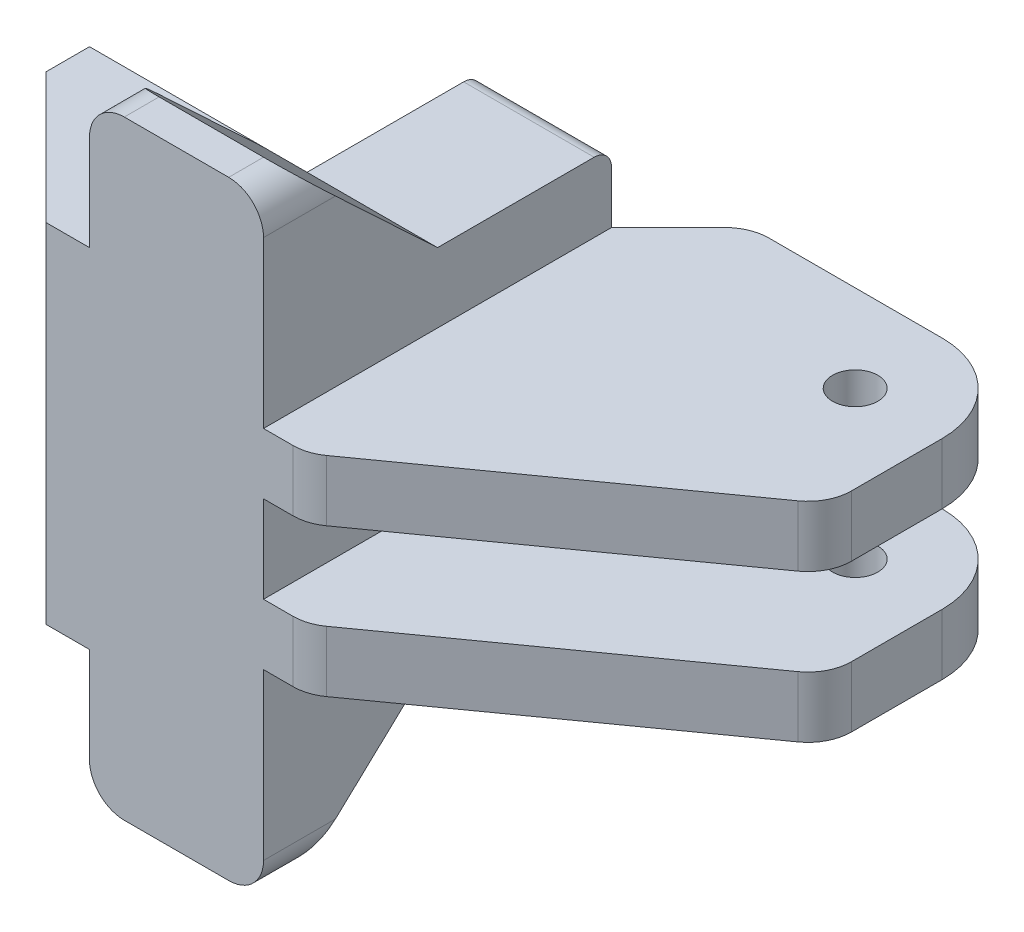
from build123d import *

# Parameters (mm, degrees)
SKETCH1_W                = 40
SKETCH1_H                = 40
BOSS_EXTRUDE1_DEPTH      = 40
SKETCH2_W                = 25
SKETCH2_H                = 20
CUT_EXTRUDE1_DEPTH       = 40
CHAMFER1_SIZE            = 15
CUT_EXTRUDE2_DEPTH       = 15
CHAMFER2_SIZE            = 4
SKETCH4_R                = 2.6
CUT_EXTRUDE3_DEPTH       = 17
BOSS_EXTRUDE2_DEPTH      = 8
BOSS_EXTRUDE2_DEPTH_BACK = 40
SKETCH5_W                = 40
SKETCH5_H                = 7
CHAMFER3_SIZE            = 35
CHAMFER3_SIZE2           = 25
CHAMFER4_SIZE            = 25
CHAMFER4_SIZE2           = 35
CHAMFER5_SIZE            = 8
FILLET1_R                = 10
FILLET2_R                = 5
SKETCH8_R                = 2.6
CUT_EXTRUDE4_DEPTH       = 34
BOSS_EXTRUDE3_DEPTH      = 20
FILLET3_R                = 4
FILLET4_R                = 2
CUT_EXTRUDE5_DEPTH       = 26
CHAMFER6_SIZE            = 2
CHAMFER6_SIZE2           = 10
FILLET5_R                = 2


with BuildPart() as part:
    # Sketch1 → Boss-Extrude1 (new body)
    with BuildSketch(Plane(origin=(0, 0, 0), x_dir=(1, 0, 0), z_dir=(0, 1, 0))):
        with Locations((20, 20)):
            Rectangle(SKETCH1_W, SKETCH1_H)
    extrude(amount=BOSS_EXTRUDE1_DEPTH)

    # Sketch2 → Cut-Extrude1 (cut)
    with BuildSketch(Plane(origin=(0, 40, 0), x_dir=(1, 0, 0), z_dir=(0, 1, 0))):
        with Locations((12.5, 30)):
            Rectangle(SKETCH2_W, SKETCH2_H)
    extrude(amount=-CUT_EXTRUDE1_DEPTH, mode=Mode.SUBTRACT)

    # Chamfer1
    chamfer1_edges = [part.edges().sort_by_distance(p)[0] for p in [
        (0, 20, 0),
    ]]
    chamfer(chamfer1_edges, length=CHAMFER1_SIZE)

    # Sketch3 → Cut-Extrude2 (cut)
    with BuildSketch(Plane.XY):
        Polygon((0, 10), (0, 15), (15, 15), (15, 5), (0, 5), align=None)
        Polygon((0, 30), (0, 25), (15, 25), (15, 35), (0, 35), align=None)
    extrude(amount=-CUT_EXTRUDE2_DEPTH, mode=Mode.SUBTRACT)

    # Chamfer2
    chamfer2_edges = [part.edges().sort_by_distance(p)[0] for p in [
        (15, 35, -7.5),
        (15, 25, -7.5),
        (15, 15, -7.5),
        (15, 5, -7.5),
    ]]
    chamfer(chamfer2_edges, length=CHAMFER2_SIZE)

    # Sketch4 → Cut-Extrude3 (cut)
    with BuildSketch(Plane.XY.offset(-15)):
        with Locations((8, 30)):
            Circle(SKETCH4_R)
        with Locations((8, 10)):
            Circle(SKETCH4_R)
    extrude(amount=-CUT_EXTRUDE3_DEPTH, mode=Mode.SUBTRACT)

    # Sketch5 → Boss-Extrude2 (add, two sides: drawn at the far end of the back side and taken through both)
    with BuildSketch(Plane(origin=(0, 0, -40), x_dir=(-1, 0, 0), z_dir=(0, 0, -1)).offset(-BOSS_EXTRUDE2_DEPTH_BACK)):
        with Locations((-60, 11.5)):
            Rectangle(SKETCH5_W, SKETCH5_H)
        with Locations((-60, 28.5)):
            Rectangle(SKETCH5_W, SKETCH5_H)
    extrude(amount=BOSS_EXTRUDE2_DEPTH + BOSS_EXTRUDE2_DEPTH_BACK)

    # Chamfer3
    chamfer3_edges = [part.edges().sort_by_distance(p)[0] for p in [
        (80, 28.5, 0),
    ]]
    chamfer3_side = [part.faces().sort_by_distance(p)[0] for p in [
        (39.166666667, 20, 0),
    ]]
    chamfer(chamfer3_edges, length=CHAMFER3_SIZE, length2=CHAMFER3_SIZE2, reference=chamfer3_side[0])

    # Chamfer4
    chamfer4_edges = [part.edges().sort_by_distance(p)[0] for p in [
        (80, 11.5, 0),
    ]]
    chamfer4_side = [part.faces().sort_by_distance(p)[0] for p in [
        (80, 11.5, -24),
    ]]
    chamfer(chamfer4_edges, length=CHAMFER4_SIZE, length2=CHAMFER4_SIZE2, reference=chamfer4_side[0])

    # Chamfer5
    chamfer5_edges = [part.edges().sort_by_distance(p)[0] for p in [
        (40, 28.5, -48),
        (40, 11.5, -48),
    ]]
    chamfer(chamfer5_edges, length=CHAMFER5_SIZE - 0.0001)  # a hair under: the kernel refuses the full size

    # Fillet1
    fillet1_edges = [part.edges().sort_by_distance(p)[0] for p in [
        (80, 11.5, -48),
        (80, 28.5, -48),
    ]]
    fillet(fillet1_edges, radius=FILLET1_R)

    # Fillet2
    fillet2_edges = [part.edges().sort_by_distance(p)[0] for p in [
        (80, 28.5, -25),
        (45, 28.5, 0),
        (45, 11.5, 0),
        (80, 11.5, -25),
        (47.9999, 28.5, -48),
        (47.9999, 11.5, -48),
    ]]
    fillet(fillet2_edges, radius=FILLET2_R)

    # Sketch8 → Cut-Extrude4 (cut)
    with BuildSketch(Plane(origin=(0, 32, 0), x_dir=(1, 0, 0), z_dir=(0, 1, 0))):
        with Locations(Location((70, 38, 0), (0, 0, 270))):
            Circle(SKETCH8_R)
    extrude(amount=-CUT_EXTRUDE4_DEPTH, mode=Mode.SUBTRACT)

    # Sketch9 → Boss-Extrude3 (add)
    with BuildSketch(Plane(origin=(40, 0, 0), x_dir=(0, 0, -1), z_dir=(1, 0, 0))):
        Polygon((0, 40), (0, 55), (4, 55), (20, 40), align=None)
        Polygon((0, 0), (0, -15), (4, -15), (20, 0), align=None)
    extrude(amount=-BOSS_EXTRUDE3_DEPTH)

    # Fillet3
    fillet3_edges = [part.edges().sort_by_distance(p)[0] for p in [
        (20, 55, -2),
        (40, 55, -2),
        (20, -15, -2),
        (40, -15, -2),
    ]]
    fillet(fillet3_edges, radius=FILLET3_R)

    # Fillet4
    fillet4_edges = [part.edges().sort_by_distance(p)[0] for p in [
        (32.5, 40, -40),
        (32.5, 0, -40),
    ]]
    fillet(fillet4_edges, radius=FILLET4_R)

    # Sketch10 → Cut-Extrude5 (cut)
    with BuildSketch(Plane(origin=(40, 0, 0), x_dir=(0, 0, -1), z_dir=(1, 0, 0))):
        Polygon((22, 15), (36, 15), (36, 20), (36, 25), (22, 25), align=None)
    extrude(amount=-CUT_EXTRUDE5_DEPTH, mode=Mode.SUBTRACT)

    # Chamfer6
    chamfer6_edges = [part.edges().sort_by_distance(p)[0] for p in [
        (40, 20, -36),
    ]]
    chamfer6_side = [part.faces().sort_by_distance(p)[0] for p in [
        (40, 20, -38),
    ]]
    chamfer(chamfer6_edges, length=CHAMFER6_SIZE, length2=CHAMFER6_SIZE2, reference=chamfer6_side[0])

    # Fillet5
    fillet5_edges = [part.edges().sort_by_distance(p)[0] for p in [
        (32.5, 25, -22),
        (27.5, 25, -36),
        (27.5, 15, -36),
        (32.5, 15, -22),
        (35, 25, -37),
        (35, 15, -37),
    ]]
    fillet(fillet5_edges, radius=FILLET5_R)


solid = part.part
